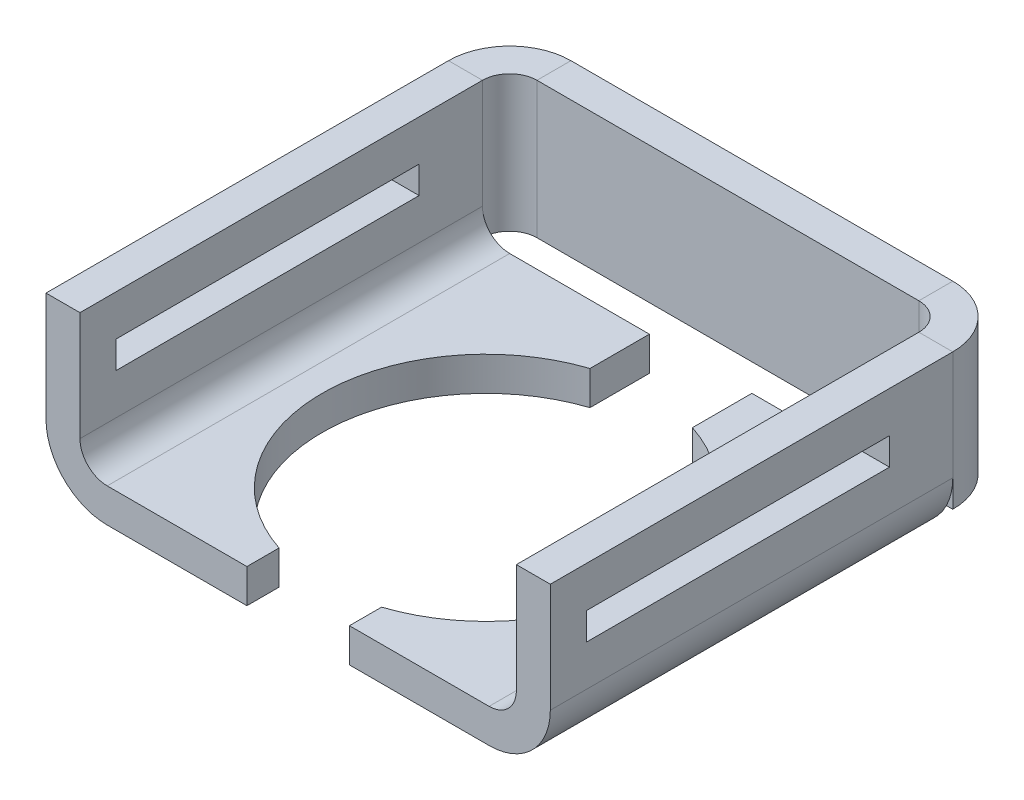
from build123d import *

# Parameters (mm, degrees)
SKETCH1_W                      = 16
SKETCH1_H                      = 5
BASE_FLANGE1_DEPTH             = 1.2446
EDGE_FLANGE1_STRIP_W           = 6.9784
EDGE_FLANGE1_STRIP_H           = 1.2446
EDGE_FLANGE1_STRIP_CUT_DEPTH   = 5
EDGE_FLANGE1_STRIP_2_W         = 6.9784
EDGE_FLANGE1_STRIP_2_H         = 1.2446
EDGE_FLANGE1_STRIP_CUT_2_DEPTH = 5
EDGE_FLANGE1_DEPTH             = 5
EDGE_FLANGE1_BEND_DEPTH        = 5
EDGE_FLANGE2_STRIP_W           = 6.9784
EDGE_FLANGE2_STRIP_H           = 1.2446
EDGE_FLANGE2_STRIP_CUT_DEPTH   = 15.7554
EDGE_FLANGE2_STRIP_2_W         = 6.9784
EDGE_FLANGE2_STRIP_2_H         = 1.2446
EDGE_FLANGE2_STRIP_CUT_2_DEPTH = 15.7554
EDGE_FLANGE2_DEPTH             = 15.7554
EDGE_FLANGE2_BEND_DEPTH        = 15.7554
SKETCH15_R                     = 6
CUT_EXTRUDE1_DEPTH             = 20.778929656
SKETCH16_W                     = 11.1125
SKETCH16_H                     = 1
CUT_EXTRUDE2_DEPTH             = 26.231249968
SKETCH17_W                     = 18.4892
SKETCH17_H                     = 1
CUT_EXTRUDE3_DEPTH             = 21.129607236


# Sheet-metal steps are written as plain solids
with BuildPart() as part:
    # Sketch1 → Base-Flange1 (new body)
    with BuildSketch(Plane.XY):
        Rectangle(SKETCH1_W, SKETCH1_H)
    extrude(amount=-BASE_FLANGE1_DEPTH)

    # Edge-Flange1 strip (across the edge) → Edge-Flange1 strip cut (cut)
    with BuildSketch(Plane(origin=(8, -2.5, 0), x_dir=(-1, 0, 0), z_dir=(0, 1, 0))):
        with Locations((-2.4892, -0.6223)):
            Rectangle(EDGE_FLANGE1_STRIP_W, EDGE_FLANGE1_STRIP_H)
    extrude(amount=EDGE_FLANGE1_STRIP_CUT_DEPTH, mode=Mode.SUBTRACT)

    # Edge-Flange1 strip 2 (across the edge) → Edge-Flange1 strip cut 2 (cut)
    with BuildSketch(Plane(origin=(-8, 2.5, 0), x_dir=(1, 0, 0), z_dir=(0, -1, 0))):
        with Locations((-2.4892, -0.6223)):
            Rectangle(EDGE_FLANGE1_STRIP_2_W, EDGE_FLANGE1_STRIP_2_H)
    extrude(amount=EDGE_FLANGE1_STRIP_CUT_2_DEPTH, mode=Mode.SUBTRACT)

    # Edge-Flange1 section (across the edge) → Edge-Flange1 (add)
    with BuildSketch(Plane(origin=(8, -2.5, 0), x_dir=(-1, 0, 0), z_dir=(0, 1, 0))):
        with BuildLine():
            Line((-1.2446, 1), (-1.2446, 16.7554))
            Line((-1.2446, 16.7554), (0, 16.7554))
            Line((0, 16.7554), (0, 1))
            ThreePointArc((0, 1), (0.292893219, 0.292893219), (1, 0))
            Line((1, 0), (1, -1.2446))
            ThreePointArc((1, -1.2446), (-0.587171881, -0.587171881), (-1.2446, 1))
        make_face()
    extrude(amount=EDGE_FLANGE1_DEPTH)

    # Edge-Flange1 section 2 (across the edge) → Edge-Flange1 bend (add)
    with BuildSketch(Plane(origin=(-8, 2.5, 0), x_dir=(1, 0, 0), z_dir=(0, -1, 0))):
        with BuildLine():
            Line((-1.2446, 1), (-1.2446, 16.7554))
            Line((-1.2446, 16.7554), (0, 16.7554))
            Line((0, 16.7554), (0, 1))
            ThreePointArc((0, 1), (0.292893219, 0.292893219), (1, 0))
            Line((1, 0), (1, -1.2446))
            ThreePointArc((1, -1.2446), (-0.587171881, -0.587171881), (-1.2446, 1))
        make_face()
    extrude(amount=EDGE_FLANGE1_BEND_DEPTH)

    # Edge-Flange2 strip (across the edge) → Edge-Flange2 strip cut (cut)
    with BuildSketch(Plane(origin=(-8, -2.5, 16.7554), x_dir=(0, 1, 0), z_dir=(0, 0, -1))):
        with Locations((-2.4892, -0.6223)):
            Rectangle(EDGE_FLANGE2_STRIP_W, EDGE_FLANGE2_STRIP_H)
    extrude(amount=EDGE_FLANGE2_STRIP_CUT_DEPTH, mode=Mode.SUBTRACT)

    # Edge-Flange2 strip 2 (across the edge) → Edge-Flange2 strip cut 2 (cut)
    with BuildSketch(Plane(origin=(8, -2.5, 1), x_dir=(0, 1, 0), z_dir=(0, 0, 1))):
        with Locations((-2.4892, -0.6223)):
            Rectangle(EDGE_FLANGE2_STRIP_2_W, EDGE_FLANGE2_STRIP_2_H)
    extrude(amount=EDGE_FLANGE2_STRIP_CUT_2_DEPTH, mode=Mode.SUBTRACT)

    # Edge-Flange2 section (across the edge) → Edge-Flange2 (add)
    with BuildSketch(Plane(origin=(-8, -2.5, 16.7554), x_dir=(0, 1, 0), z_dir=(0, 0, -1))):
        with BuildLine():
            Line((-1.2446, 1), (-1.2446, 6.1214))
            Line((-1.2446, 6.1214), (0, 6.1214))
            Line((0, 6.1214), (0, 1))
            ThreePointArc((0, 1), (0.292893219, 0.292893219), (1, 0))
            Line((1, 0), (1, -1.2446))
            ThreePointArc((1, -1.2446), (-0.587171881, -0.587171881), (-1.2446, 1))
        make_face()
    extrude(amount=EDGE_FLANGE2_DEPTH)

    # Edge-Flange2 section 2 (across the edge) → Edge-Flange2 bend (add)
    with BuildSketch(Plane(origin=(8, -2.5, 1), x_dir=(0, 1, 0), z_dir=(0, 0, 1))):
        with BuildLine():
            Line((-1.2446, 1), (-1.2446, 6.1214))
            Line((-1.2446, 6.1214), (0, 6.1214))
            Line((0, 6.1214), (0, 1))
            ThreePointArc((0, 1), (0.292893219, 0.292893219), (1, 0))
            Line((1, 0), (1, -1.2446))
            ThreePointArc((1, -1.2446), (-0.587171881, -0.587171881), (-1.2446, 1))
        make_face()
    extrude(amount=EDGE_FLANGE2_BEND_DEPTH)

    # Sketch15 → Cut-Extrude1 (cut, through all)
    with BuildSketch(Plane(origin=(0, -2.5, 0), x_dir=(1, 0, 0), z_dir=(0, 1, 0))):
        with Locations((0, -8.8777)):
            Circle(SKETCH15_R)
    extrude(amount=-CUT_EXTRUDE1_DEPTH, mode=Mode.SUBTRACT)

    # Sketch16 → Cut-Extrude2 (cut, through all)
    with BuildSketch(Plane(origin=(9.2446, 0, 0), x_dir=(0, 0, -1), z_dir=(1, 0, 0))):
        with Locations((-8.8777, 0.5)):
            Rectangle(SKETCH16_W, SKETCH16_H)
    extrude(amount=-CUT_EXTRUDE2_DEPTH, mode=Mode.SUBTRACT)

    # Sketch17 → Cut-Extrude3 (cut, through all)
    with BuildSketch(Plane(origin=(0, 2.5, 0), x_dir=(1, 0, 0), z_dir=(0, 1, 0))):
        with Locations((0, -16.2554)):
            Rectangle(SKETCH17_W, SKETCH17_H)
    extrude(amount=-CUT_EXTRUDE3_DEPTH, mode=Mode.SUBTRACT)


solid = part.part
